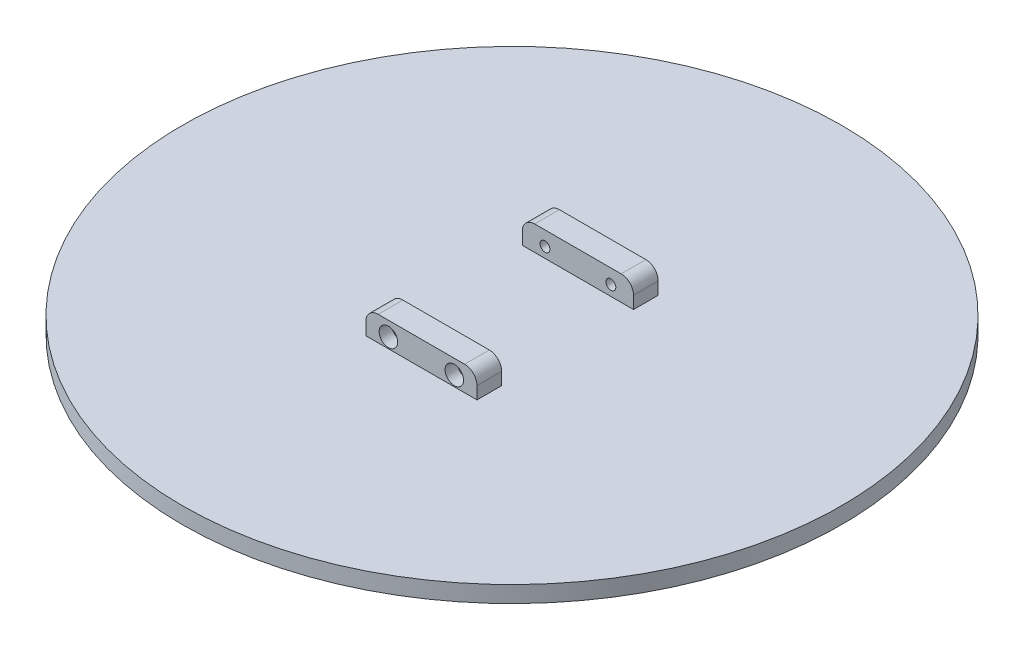
from build123d import *

# Parameters (mm, degrees)
SKETCH1_R                                           = 37.65
SKETCH1_R_2                                         = 32.65
BOSS_EXTRUDE1_DEPTH                                 = 10
BOSS_EXTRUDE2_START                                 = -4
SKETCH2_R                                           = 32.65
SKETCH2_R_2                                         = 29.65
BOSS_EXTRUDE2_DEPTH                                 = 4
SKETCH3_R                                           = 80
BOSS_EXTRUDE3_DEPTH                                 = 4
SKETCH4_W                                           = 27
SKETCH4_H                                           = 6
BOSS_EXTRUDE4_DEPTH                                 = 6
FILLET1_R                                           = 3
SKETCH6_R                                           = 2.25
CUT_EXTRUDE1_DEPTH                                  = 3
CSK_FOR_M2_COUNTERSUNK_FLAT_HEAD_SCREW1_D           = 2.4
CSK_FOR_M2_COUNTERSUNK_FLAT_HEAD_SCREW1_CSINK_D     = 4.4
CSK_FOR_M2_COUNTERSUNK_FLAT_HEAD_SCREW1_CSINK_ANGLE = 90
FILLET1_OF_MIRROR1_R                                = 3


with BuildPart() as part:
    # Sketch1 → Boss-Extrude1 (new body)
    with BuildSketch(Plane(origin=(0, 0, 0), x_dir=(1, 0, 0), z_dir=(0, 1, 0))):
        Circle(SKETCH1_R)
        Circle(SKETCH1_R_2, mode=Mode.SUBTRACT)
    extrude(amount=BOSS_EXTRUDE1_DEPTH)

    # Sketch2 → Boss-Extrude2 (add)
    with BuildSketch(Plane(origin=(0, 10, 0), x_dir=(1, 0, 0), z_dir=(0, 1, 0)).offset(BOSS_EXTRUDE2_START)):
        Circle(SKETCH2_R)
        Circle(SKETCH2_R_2, mode=Mode.SUBTRACT)
    extrude(amount=BOSS_EXTRUDE2_DEPTH)

    # Sketch3 → Boss-Extrude3 (add)
    with BuildSketch(Plane(origin=(0, 10, 0), x_dir=(1, 0, 0), z_dir=(0, 1, 0))):
        Circle(SKETCH3_R)
    extrude(amount=BOSS_EXTRUDE3_DEPTH)

    # Sketch4 → Boss-Extrude4 (add)
    with BuildSketch(Plane(origin=(0, 14, 0), x_dir=(1, 0, 0), z_dir=(0, 1, 0))):
        with Locations((0, 19)):
            Rectangle(SKETCH4_W, SKETCH4_H)
    boss_extrude4 = extrude(amount=BOSS_EXTRUDE4_DEPTH)

    # Fillet1
    fillet1_edges = [part.edges().sort_by_distance(p)[0] for p in [
        (-13.5, 20, -19),
        (13.5, 20, -19),
    ]]
    fillet(fillet1_edges, radius=FILLET1_R)

    # Sketch6 → Cut-Extrude1 (cut)
    with BuildSketch(Plane(origin=(0, 0, -22), x_dir=(-1, 0, 0), z_dir=(0, 0, -1))):
        with Locations((-8, 16.5)):
            Circle(SKETCH6_R)
        with Locations((8, 16.5)):
            Circle(SKETCH6_R)
    cut_extrude1 = extrude(amount=-CUT_EXTRUDE1_DEPTH, mode=Mode.SUBTRACT)

    # CSK for M2 Countersunk Flat Head Screw1 (through all)
    with Locations(Plane(origin=(8, 16.5, -19), x_dir=(-1, 0, 0), z_dir=(0, 0, -1))):
        with Locations((0, 0), (16, 0)):
            csk_for_m2_countersunk_flat_head_screw1 = CounterSinkHole(CSK_FOR_M2_COUNTERSUNK_FLAT_HEAD_SCREW1_D / 2, CSK_FOR_M2_COUNTERSUNK_FLAT_HEAD_SCREW1_CSINK_D / 2, counter_sink_angle=CSK_FOR_M2_COUNTERSUNK_FLAT_HEAD_SCREW1_CSINK_ANGLE)

    # Mirror1: Boss-Extrude4, Cut-Extrude1, CSK for M2 Countersunk Flat Head Screw1 across plane
    add(boss_extrude4.mirror(Plane.XY))
    add(cut_extrude1.mirror(Plane.XY), mode=Mode.SUBTRACT)
    add(csk_for_m2_countersunk_flat_head_screw1.mirror(Plane.XY), mode=Mode.SUBTRACT)

    # Fillet1 of Mirror1
    fillet1_of_mirror1_edges = [part.edges().sort_by_distance(p)[0] for p in [
        (-13.5, 20, 19),
        (13.5, 20, 19),
    ]]
    fillet(fillet1_of_mirror1_edges, radius=FILLET1_OF_MIRROR1_R)


solid = part.part
